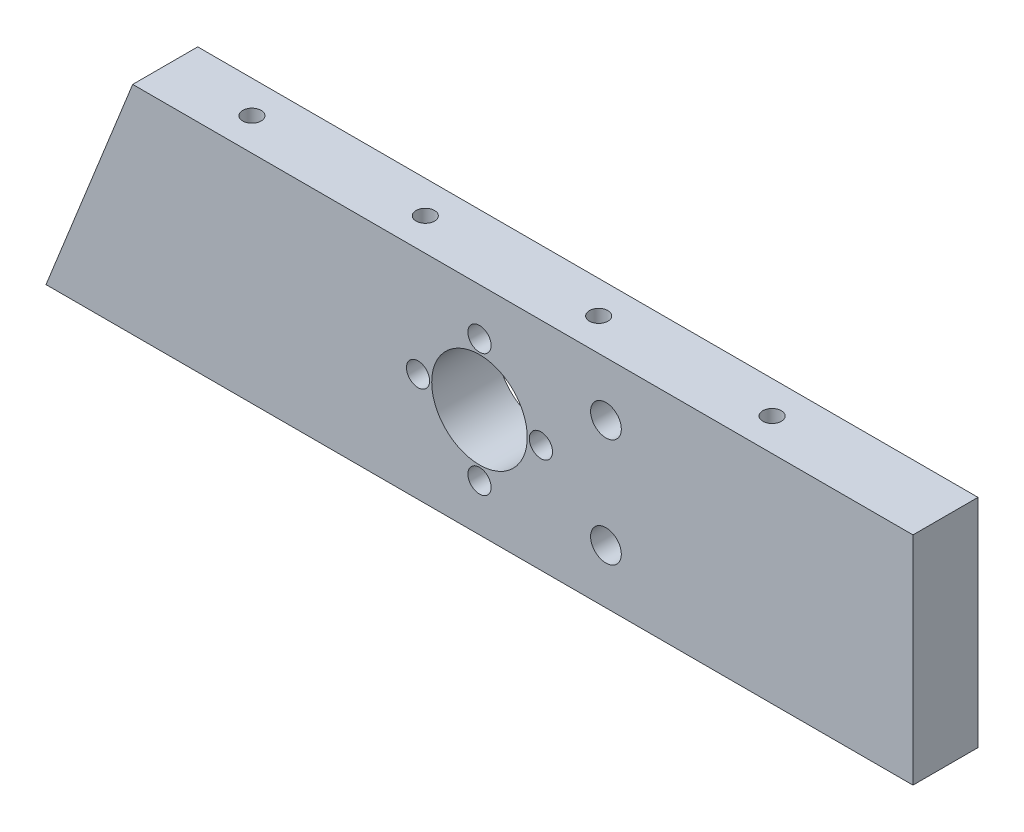
from build123d import *

# Parameters (mm, degrees)
SKETCH1_R           = 1.7
SKETCH1_R_2         = 7
SKETCH1_R_3         = 2.2479
BOSS_EXTRUDE1_DEPTH = 9.525
LPATTERN1_COUNT     = 4
LPATTERN1_PITCH     = 25.4


with BuildPart() as part:
    # Sketch1 → Boss-Extrude1 (new body)
    with BuildSketch(Plane.XY):
        Polygon((-50.8, 15.875), (63.5, 15.875), (63.5, -15.875), (-63.5, -15.875), align=None)
        with Locations((0, -9)):
            Circle(SKETCH1_R, mode=Mode.SUBTRACT)
        with Locations((-9, 0)):
            Circle(SKETCH1_R, mode=Mode.SUBTRACT)
        with Locations((0, 9)):
            Circle(SKETCH1_R, mode=Mode.SUBTRACT)
        with Locations((9, 0)):
            Circle(SKETCH1_R, mode=Mode.SUBTRACT)
        Circle(SKETCH1_R_2, mode=Mode.SUBTRACT)
        with Locations((18.525, 7.9375)):
            Circle(SKETCH1_R_3, mode=Mode.SUBTRACT)
        with Locations((18.525, -7.9375)):
            Circle(SKETCH1_R_3, mode=Mode.SUBTRACT)
    extrude(amount=BOSS_EXTRUDE1_DEPTH)

    # Sketch12 → Tap Drill for #6-32 Tap1 (revolve, cut)
    with BuildSketch(Plane(origin=(38.1, -15.875, 4.7625), x_dir=(0, 0, -1), z_dir=(1, 0, 0))):
        Polygon((0, 0), (0, 13.51269403), (1.35255, 12.7), (1.35255, 0), align=None)
    tap_drill_for_6_32_tap1 = revolve(axis=Axis((38.1, -22.225, 4.7625), (0, 1, 0)), mode=Mode.SUBTRACT)

    # LPattern1: Tap Drill for #6-32 Tap1 ×4
    with Locations(*[(-i * LPATTERN1_PITCH, 0, 0) for i in range(1, LPATTERN1_COUNT)]):
        add(tap_drill_for_6_32_tap1, mode=Mode.SUBTRACT)

    # Mirror8: Tap Drill for #6-32 Tap1 across plane
    add(tap_drill_for_6_32_tap1.mirror(Plane.ZX), mode=Mode.SUBTRACT)

    # Mirror8 copy 1 sketch → Mirror8 copy 1 (revolve, cut)
    with BuildSketch(Plane(origin=(12.7, 15.875, 4.7625), x_dir=(0, 0, -1), z_dir=(1, 0, 0))):
        Polygon((0, 0), (0, -13.51269403), (1.35255, -12.7), (1.35255, 0), align=None)
    revolve(axis=Axis((12.7, 22.225, 4.7625), (0, 1, 0)), mode=Mode.SUBTRACT)

    # Mirror8 copy 2 sketch → Mirror8 copy 2 (revolve, cut)
    with BuildSketch(Plane(origin=(-12.7, 15.875, 4.7625), x_dir=(0, 0, -1), z_dir=(1, 0, 0))):
        Polygon((0, 0), (0, -13.51269403), (1.35255, -12.7), (1.35255, 0), align=None)
    revolve(axis=Axis((-12.7, 22.225, 4.7625), (0, 1, 0)), mode=Mode.SUBTRACT)

    # Mirror8 copy 3 sketch → Mirror8 copy 3 (revolve, cut)
    with BuildSketch(Plane(origin=(-38.1, 15.875, 4.7625), x_dir=(0, 0, -1), z_dir=(1, 0, 0))):
        Polygon((0, 0), (0, -13.51269403), (1.35255, -12.7), (1.35255, 0), align=None)
    revolve(axis=Axis((-38.1, 22.225, 4.7625), (0, 1, 0)), mode=Mode.SUBTRACT)


solid = part.part
